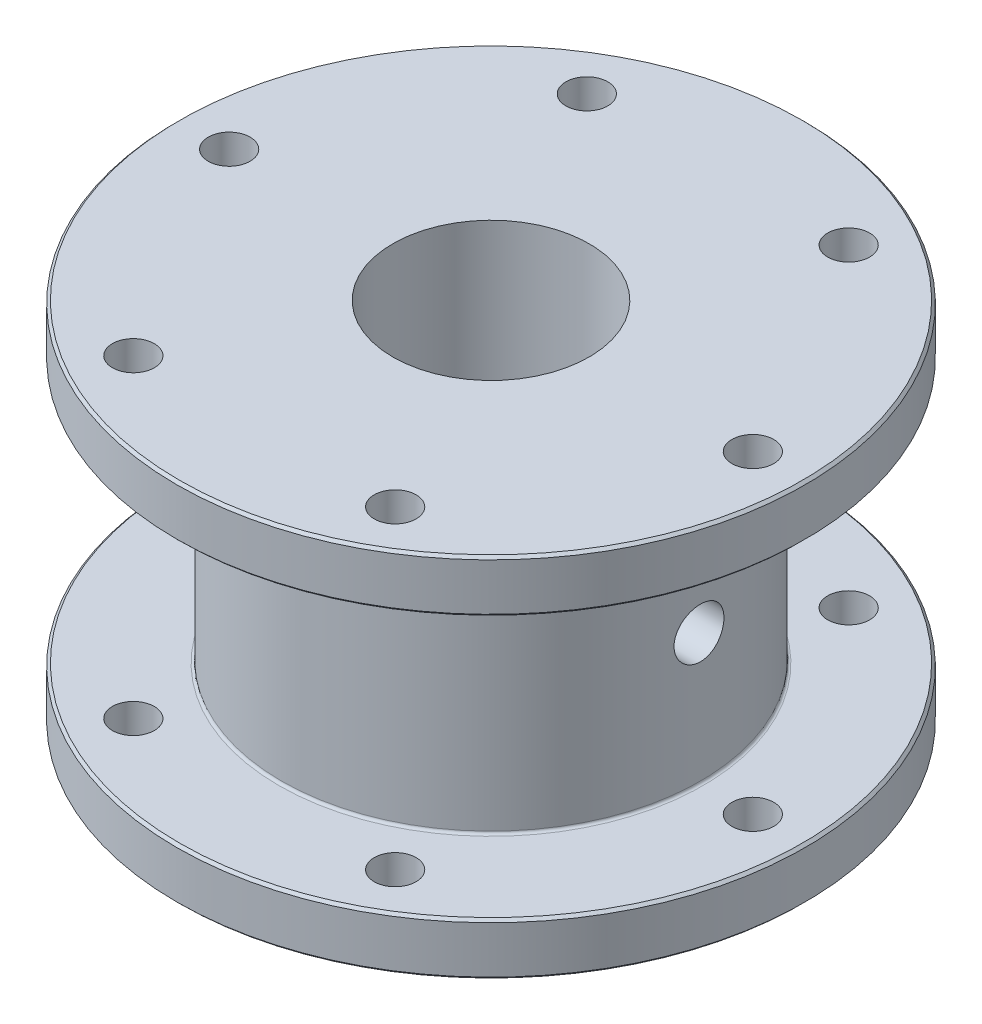
from build123d import *

# Parameters (mm, degrees)
CROQUIS1_R                 = 60
CROQUIS1_R_2               = 18.75
CROQUIS1_R_3               = 4
SALIENTE_EXTRUIR1_DEPTH    = 10
CROQUIS2_R                 = 40
CROQUIS2_R_2               = 18.75
SALIENTE_EXTRUIR2_DEPTH    = 50
CHAFL_N2_SIZE              = 0.5
REDONDEO1_R                = 0.5
CORTAR_EXTRUIR1_DEPTH      = 104.923048454
CORTAR_EXTRUIR1_DEPTH_BACK = 104.923048454
CROQUIS3_R                 = 4.7625
CHAFL_N3_SIZE              = 0.5
REDONDEO3_R                = 0.5


with BuildPart() as part:
    # Croquis1 → Saliente-Extruir1 (new body)
    with BuildSketch(Plane(origin=(0, 0, 0), x_dir=(1, 0, 0), z_dir=(0, 1, 0))):
        Circle(CROQUIS1_R)
        Circle(CROQUIS1_R_2, mode=Mode.SUBTRACT)
        with Locations((25, -43.301270189)):
            Circle(CROQUIS1_R_3, mode=Mode.SUBTRACT)
        with Locations((-25, -43.301270189)):
            Circle(CROQUIS1_R_3, mode=Mode.SUBTRACT)
        with Locations((-50, 0)):
            Circle(CROQUIS1_R_3, mode=Mode.SUBTRACT)
        with Locations((-25, 43.301270189)):
            Circle(CROQUIS1_R_3, mode=Mode.SUBTRACT)
        with Locations((25, 43.301270189)):
            Circle(CROQUIS1_R_3, mode=Mode.SUBTRACT)
        with Locations((50, 0)):
            Circle(CROQUIS1_R_3, mode=Mode.SUBTRACT)
    saliente_extruir1 = extrude(amount=SALIENTE_EXTRUIR1_DEPTH)

    # Croquis2 → Saliente-Extruir2 (add)
    with BuildSketch(Plane(origin=(0, 10, 0), x_dir=(1, 0, 0), z_dir=(0, 1, 0))):
        Circle(CROQUIS2_R)
        Circle(CROQUIS2_R_2, mode=Mode.SUBTRACT)
    extrude(amount=SALIENTE_EXTRUIR2_DEPTH)

    # Chaflán2
    chafl_n2_edges = [part.edges().sort_by_distance(p)[0] for p in [
        (-60, 10, 0),
        (-60, 0, 0),
    ]]
    chamfer(chafl_n2_edges, length=CHAFL_N2_SIZE)

    # Redondeo1
    redondeo1_edges = [part.edges().sort_by_distance(p)[0] for p in [
        (-40, 10, 0),
    ]]
    fillet(redondeo1_edges, radius=REDONDEO1_R)

    # Croquis3 → Cortar-Extruir1 (cut, two sides: drawn at the far end of the back side and taken through both)
    with BuildSketch(Plane(origin=(0, 0, 0), x_dir=(0, 0, -1), z_dir=(1, 0, 0)).offset(-CORTAR_EXTRUIR1_DEPTH_BACK)):
        with Locations((0, 35)):
            Circle(CROQUIS3_R)
    extrude(amount=CORTAR_EXTRUIR1_DEPTH + CORTAR_EXTRUIR1_DEPTH_BACK, mode=Mode.SUBTRACT)

    # Simetría1: Saliente-Extruir1 across plane
    add(saliente_extruir1.mirror(Plane.ZX.offset(35)))

    # Chaflán3
    chafl_n3_edges = [part.edges().sort_by_distance(p)[0] for p in [
        (-60, 70, 0),
        (-60, 60, 0),
    ]]
    chamfer(chafl_n3_edges, length=CHAFL_N3_SIZE)

    # Redondeo3
    redondeo3_edges = [part.edges().sort_by_distance(p)[0] for p in [
        (-40, 60, 0),
    ]]
    fillet(redondeo3_edges, radius=REDONDEO3_R)


solid = part.part
